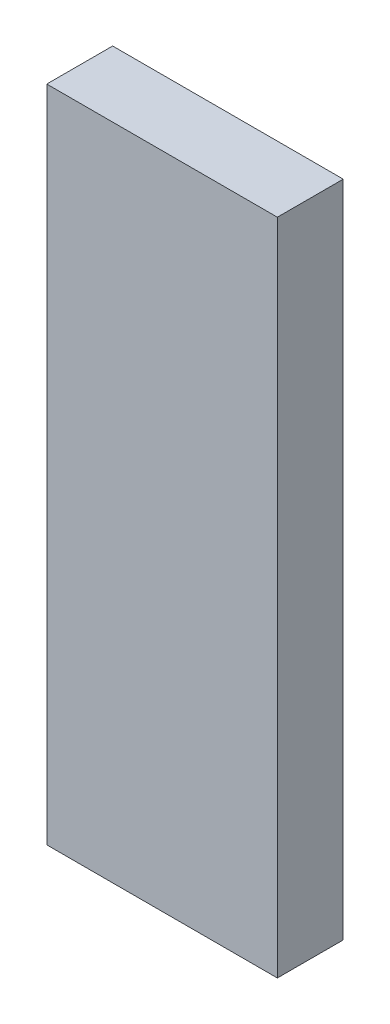
from build123d import *

# Parameters (mm, degrees)
SKETCH1_W           = 7
SKETCH1_H           = 20
BOSS_EXTRUDE1_DEPTH = 2


with BuildPart() as part:
    # Sketch1 → Boss-Extrude1 (new body)
    with BuildSketch(Plane.XY):
        Rectangle(SKETCH1_W, SKETCH1_H)
    extrude(amount=BOSS_EXTRUDE1_DEPTH)


solid = part.part
